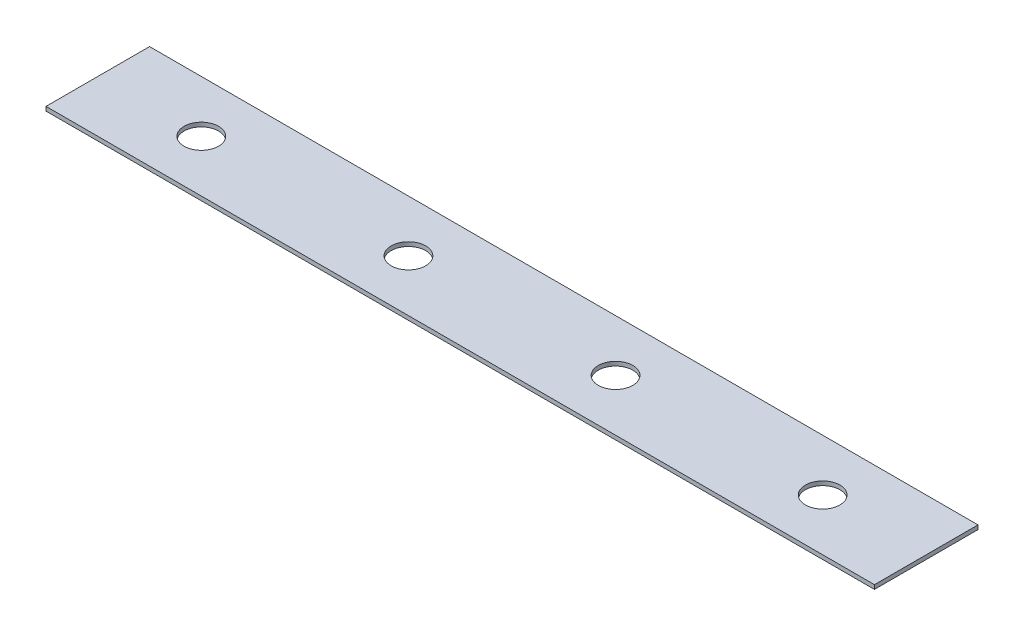
from build123d import *

# Parameters (mm, degrees)
SKETCH1_W           = 38.1
SKETCH1_H           = 1.51892
BOSS_EXTRUDE1_DEPTH = 304.8
SKETCH3_R           = 6.35
CUT_EXTRUDE1_DEPTH  = 308.175775604


with BuildPart() as part:
    # Sketch1 → Boss-Extrude1 (new body)
    with BuildSketch(Plane(origin=(0, 0, 0), x_dir=(0, 0, -1), z_dir=(1, 0, 0))):
        with Locations((19.05, 0.75946)):
            Rectangle(SKETCH1_W, SKETCH1_H)
    extrude(amount=BOSS_EXTRUDE1_DEPTH)

    # Sketch3 → Cut-Extrude1 (cut, through all)
    with BuildSketch(Plane(origin=(0, 1.51892, 0), x_dir=(1, 0, 0), z_dir=(0, 1, 0))):
        with Locations((114.3, 19.05)):
            Circle(SKETCH3_R)
        with Locations((190.5, 19.05)):
            Circle(SKETCH3_R)
        with Locations((266.7, 19.05)):
            Circle(SKETCH3_R)
        with Locations((38.1, 19.05)):
            Circle(SKETCH3_R)
    extrude(amount=-CUT_EXTRUDE1_DEPTH, mode=Mode.SUBTRACT)


solid = part.part
